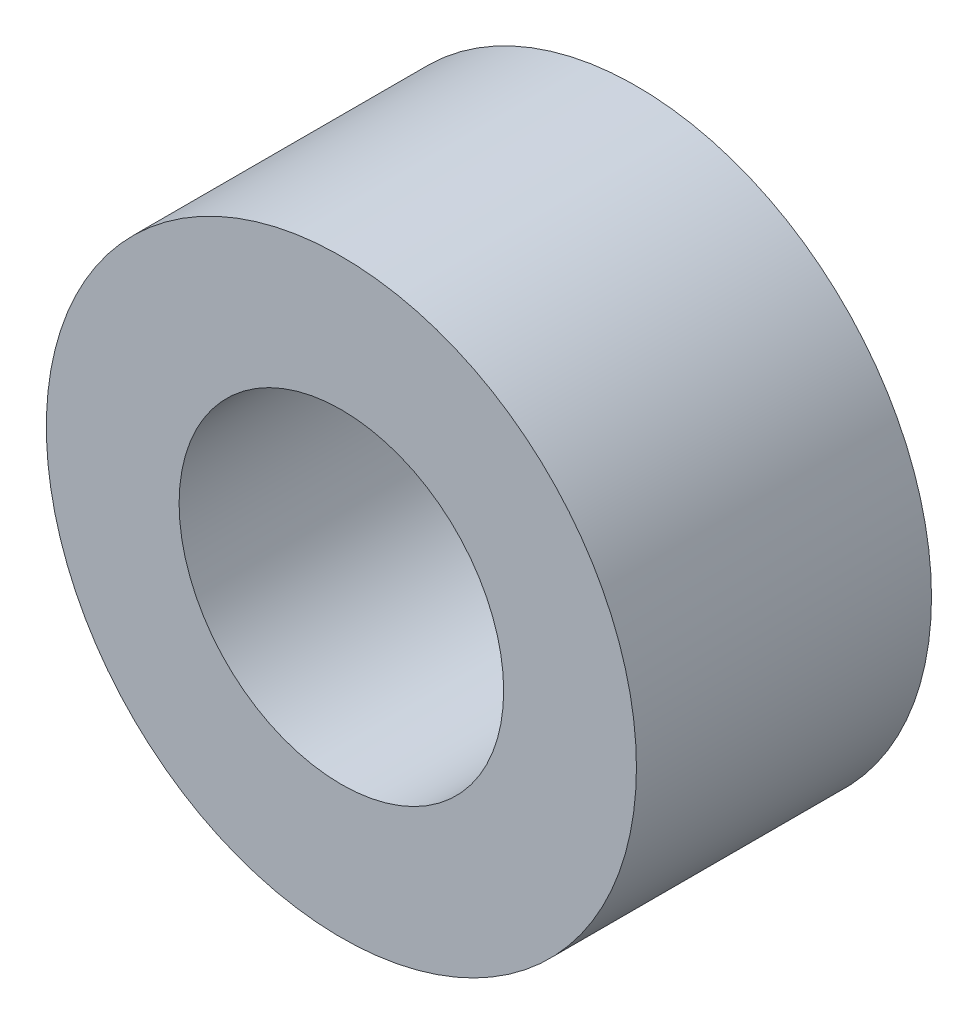
from build123d import *

# Parameters (mm, degrees)
SKETCH1_R           = 20
SKETCH1_R_2         = 11
BOSS_EXTRUDE1_DEPTH = 20


with BuildPart() as part:
    # Sketch1 → Boss-Extrude1 (new body)
    with BuildSketch(Plane.XY):
        Circle(SKETCH1_R)
        Circle(SKETCH1_R_2, mode=Mode.SUBTRACT)
    extrude(amount=BOSS_EXTRUDE1_DEPTH)


solid = part.part
